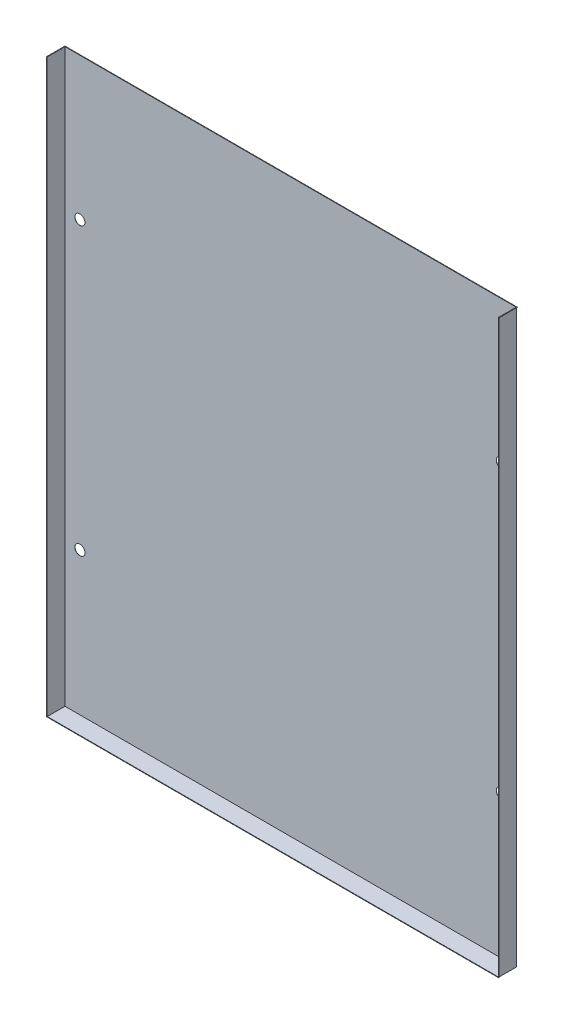
from build123d import *

# Parameters (mm, degrees)
SKETCH1_W             = 89.6514
SKETCH1_H             = 226.9314
SKETCH1_R             = 2
HEAT_EXCHANGER_DEPTH  = 0.0686
CONVECTION_FINS_DEPTH = 7.0524
TOP_OVERWRAP_DEPTH    = 0.0686
SIDE_OVERWRAP_DEPTH   = 0.0686


with BuildPart() as part:
    # Sketch1 → Heat Exchanger (new body)
    with BuildSketch(Plane.XY):
        with Locations((-44.8257, 0)):
            Rectangle(SKETCH1_W, SKETCH1_H)
        with Locations((-83.71996294, -56.7081132)):
            Circle(SKETCH1_R, mode=Mode.SUBTRACT)
        with Locations((-83.71996294, 56.94427919)):
            Circle(SKETCH1_R, mode=Mode.SUBTRACT)
    heat_exchanger = extrude(amount=HEAT_EXCHANGER_DEPTH)

    # Sketch3 → Convection Fins (add)
    with BuildSketch(Plane.XY):
        Polygon((0, -113.5343), (0, -113.4657), (-89.6514, -113.4657), (-89.6514, 113.4657), (-89.72, 113.4657), (-89.72, -113.5343), align=None)
    convection_fins = extrude(amount=CONVECTION_FINS_DEPTH)

    # Sketch5 → Top Overwrap (add)
    with BuildSketch(Plane(origin=(0, 113.4657, 0), x_dir=(1, 0, 0), z_dir=(0, 1, 0))):
        Polygon((-89.8724, -7.0524), (-89.6514, -7.0524), (-89.6514, -0.0686), (0, -0.0686), (0, 0.1524), (-89.8724, 0.1524), align=None)
    top_overwrap = extrude(amount=TOP_OVERWRAP_DEPTH)

    # Sketch7 → Side Overwrap (add)
    with BuildSketch(Plane.XY.offset(7.0524)):
        Polygon((-89.8724, 113.5343), (-89.6514, 113.5343), (-89.6514, -113.4657), (0, -113.4657), (0, -113.6867), (-89.8724, -113.6867), align=None)
    side_overwrap = extrude(amount=SIDE_OVERWRAP_DEPTH)

    # Mirror1: Heat Exchanger, Convection Fins, Top Overwrap, Side Overwrap across plane
    add(heat_exchanger.mirror(Plane(origin=(0, 0, 0), x_dir=(0, 0, 1), z_dir=(1, 0, 0))))
    add(convection_fins.mirror(Plane(origin=(0, 0, 0), x_dir=(0, 0, 1), z_dir=(1, 0, 0))))
    add(top_overwrap.mirror(Plane(origin=(0, 0, 0), x_dir=(0, 0, 1), z_dir=(1, 0, 0))))
    add(side_overwrap.mirror(Plane(origin=(0, 0, 0), x_dir=(0, 0, 1), z_dir=(1, 0, 0))))


solid = part.part
